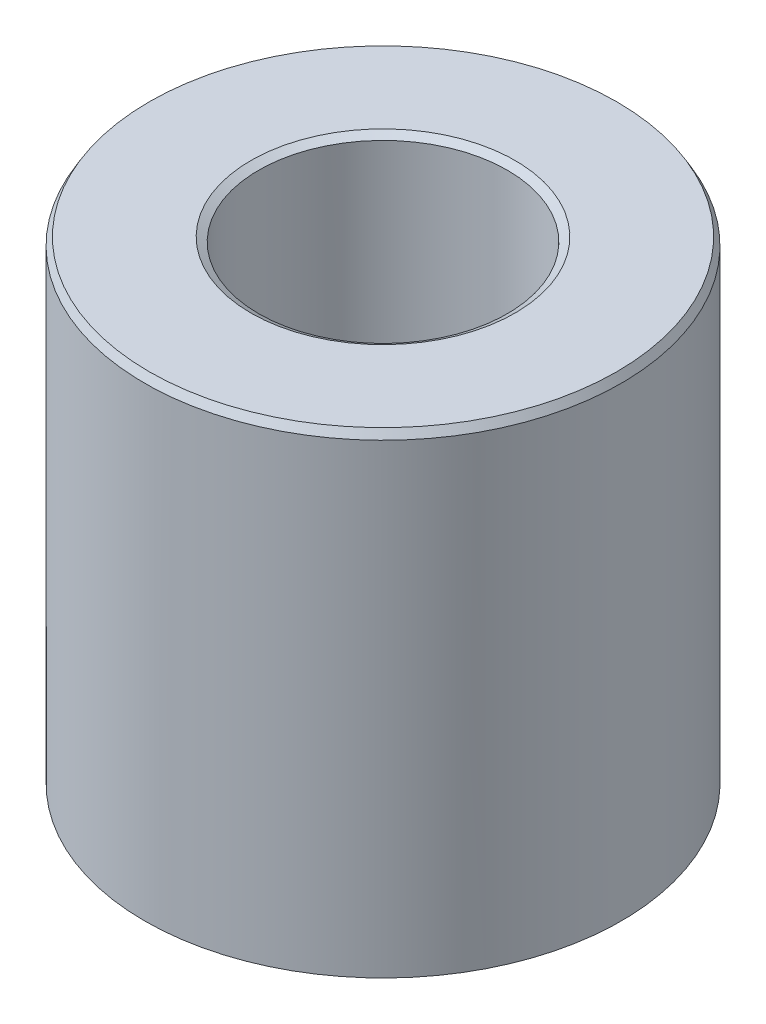
from build123d import *
from OCP.BRepFilletAPI import BRepFilletAPI_MakeChamfer

# Parameters (mm, degrees)
SKETCH1_R           = 20
BOSS_EXTRUDE1_DEPTH = 40.116919625
SKETCH2_R           = 10.437875027
CUT_EXTRUDE1_DEPTH  = 50.085305746
CHAMFER1_SIZE       = 0.65283711
CHAMFER1_SIZE2      = 0.376915681


with BuildPart() as part:
    # Sketch1 → Boss-Extrude1 (new body)
    with BuildSketch(Plane(origin=(0, 0, 0), x_dir=(1, 0, 0), z_dir=(0, 1, 0))):
        Circle(SKETCH1_R)
    extrude(amount=BOSS_EXTRUDE1_DEPTH)

    # Sketch2 → Cut-Extrude1 (cut, through all)
    with BuildSketch(Plane(origin=(0, 0, 0), x_dir=(1, 0, 0), z_dir=(0, 1, 0))):
        Circle(SKETCH2_R)
    extrude(amount=CUT_EXTRUDE1_DEPTH, mode=Mode.SUBTRACT)

    # Chamfer1: one chamfer whose edges measure the first distance from different faces: ONE call of the kernel's chamfer builder (chamfer() names one face for all edges)
    chamfer1_edges_1 = [part.edges().sort_by_distance(p)[0] for p in [
        (-10.437875027, 40.116919625, 0),
    ]]
    chamfer1_side_1 = [part.faces().sort_by_distance(p)[0] for p in [
        (-19.434314575, 40.116919625, 0),
    ]]
    chamfer1_edges_2 = [part.edges().sort_by_distance(p)[0] for p in [
        (-10.437875027, 0, 0),
    ]]
    chamfer1_side_2 = [part.faces().sort_by_distance(p)[0] for p in [
        (-10.437875027, 20.058459812, 0),
    ]]
    chamfer1_edges_3 = [part.edges().sort_by_distance(p)[0] for p in [
        (-20, 0, 0),
    ]]
    chamfer1_side_3 = [part.faces().sort_by_distance(p)[0] for p in [
        (-19.434314575, 0, 0),
    ]]
    chamfer1_edges_4 = [part.edges().sort_by_distance(p)[0] for p in [
        (-20, 40.116919625, 0),
    ]]
    chamfer1_side_4 = [part.faces().sort_by_distance(p)[0] for p in [
        (-20, 20.058459812, 0),
    ]]
    chamfer1 = BRepFilletAPI_MakeChamfer(part.part.solid().wrapped)
    for e in chamfer1_edges_1:
        chamfer1.Add(CHAMFER1_SIZE, CHAMFER1_SIZE2, e.wrapped, chamfer1_side_1[0].wrapped)  # the first distance lies on this face
    for e in chamfer1_edges_2:
        chamfer1.Add(CHAMFER1_SIZE, CHAMFER1_SIZE2, e.wrapped, chamfer1_side_2[0].wrapped)  # the first distance lies on this face
    for e in chamfer1_edges_3:
        chamfer1.Add(CHAMFER1_SIZE, CHAMFER1_SIZE2, e.wrapped, chamfer1_side_3[0].wrapped)  # the first distance lies on this face
    for e in chamfer1_edges_4:
        chamfer1.Add(CHAMFER1_SIZE, CHAMFER1_SIZE2, e.wrapped, chamfer1_side_4[0].wrapped)  # the first distance lies on this face
    add(Compound.cast(chamfer1.Shape()), mode=Mode.REPLACE)


solid = part.part
